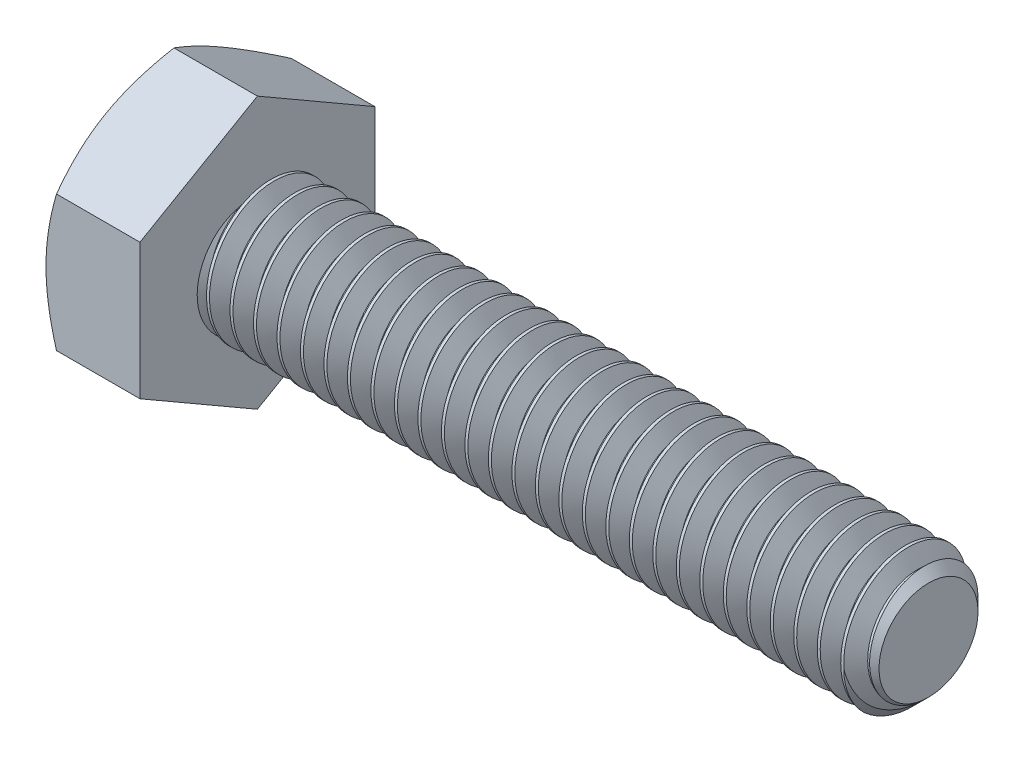
from build123d import *

# Parameters (mm, degrees)
SKETCH2_R           = 2
BOSS_EXTRUDE1_DEPTH = 20
CHAMFER1_SIZE       = 0.525
CUT_SWEEP1_PITCH    = 0.7
BOSS_EXTRUDE2_DEPTH = 2.8
SKETCH6_OUTSIDE_W   = 98.624
SKETCH6_OUTSIDE_H   = 99.706
SKETCH6_OUTSIDE_R   = 3.5
CUT_EXTRUDE1_DEPTH  = 24.418440157
CUT_EXTRUDE1_DRAFT  = -60


with BuildPart() as part:
    # Sketch2 → Boss-Extrude1 (new body)
    with BuildSketch(Plane(origin=(11.4, 0, 0), x_dir=(0, 0, -1), z_dir=(1, 0, 0))):
        Circle(SKETCH2_R)
    extrude(amount=-BOSS_EXTRUDE1_DEPTH)

    # Chamfer1
    chamfer1_edges = [part.edges().sort_by_distance(p)[0] for p in [
        (11.4, 0, 2),
    ]]
    chamfer(chamfer1_edges, length=CHAMFER1_SIZE)

    # Cut-Sweep1: the profile of Sketch5 profile screwed along a right-hand helix of 29.571429 turns, 6 arcs to a turn; built about Z, then put on its axis
    cut_sweep1_z = Axis((0, 0, 0), (0, 0, 1))
    cut_sweep1_corners = [(2.0003, 0, 0.000173205), (1.545336663, 0, -0.2625), (1.545336663, 0, -0.35), (2.0003, 0, -0.612673205)]
    with BuildLine(mode=Mode.PRIVATE) as cut_sweep1_profile:
        Line(cut_sweep1_corners[0], cut_sweep1_corners[1])
        Line(cut_sweep1_corners[1], cut_sweep1_corners[2])
        Line(cut_sweep1_corners[2], cut_sweep1_corners[3])
        Line(cut_sweep1_corners[3], cut_sweep1_corners[0])
    cut_sweep1_cap = Face(cut_sweep1_profile.wire())
    cut_sweep1_turn_angles = [0, 30, 60, 90, 120, 150, 180, 210, 240, 270, 300, 330, 360]
    cut_sweep1_turn_weights = [1, 0.8660254037844387, 1, 0.8660254037844387, 1, 0.8660254037844387, 1, 0.8660254037844387, 1, 0.8660254037844387, 1, 0.8660254037844387, 1]
    cut_sweep1_turn_rails = [Edge.make_bspline([Vector(p[0], p[1], 0).rotate(cut_sweep1_z, cut_sweep1_turn_angles[k]) / cut_sweep1_turn_weights[k] + Vector(0, 0, p[2] + CUT_SWEEP1_PITCH * cut_sweep1_turn_angles[k] / 360) for k in range(13)], [0, 0, 0, 1, 1, 2, 2, 3, 3, 4, 4, 5, 5, 6, 6, 6], 2, cut_sweep1_turn_weights) for p in cut_sweep1_corners]
    cut_sweep1_turn_sides = [Face.make_surface_from_curves(cut_sweep1_turn_rails[p[0]], cut_sweep1_turn_rails[p[1]]) for p in [(0, 1), (1, 2), (2, 3), (3, 0)]]
    cut_sweep1_last_angles = [10440, 10470, 10500, 10530, 10560, 10590, 10620, 10632.857142857, 10645.714285714]
    cut_sweep1_last_weights = [1, 0.8660254037844387, 1, 0.8660254037844387, 1, 0.8660254037844387, 1, 0.9749279121817342, 1]
    cut_sweep1_last_rails = [Edge.make_bspline([Vector(p[0], p[1], 0).rotate(cut_sweep1_z, cut_sweep1_last_angles[k]) / cut_sweep1_last_weights[k] + Vector(0, 0, p[2] + CUT_SWEEP1_PITCH * cut_sweep1_last_angles[k] / 360) for k in range(9)], [0, 0, 0, 1, 1, 2, 2, 3, 3, 4, 4, 4], 2, cut_sweep1_last_weights) for p in cut_sweep1_corners]
    cut_sweep1_last_sides = [Face.make_surface_from_curves(cut_sweep1_last_rails[p[0]], cut_sweep1_last_rails[p[1]]) for p in [(0, 1), (1, 2), (2, 3), (3, 0)]]
    cut_sweep1 = Plane(origin=(11.4, 0, 0), x_dir=(0, 1, 0), z_dir=(-1, 0, 0)) * Solid(Shell([*[p.moved(Location((0, 0, CUT_SWEEP1_PITCH * i))) for i in range(29) for p in cut_sweep1_turn_sides], *cut_sweep1_last_sides, cut_sweep1_cap, cut_sweep1_cap.rotate(cut_sweep1_z, 10645.714285714).moved(Location((0, 0, CUT_SWEEP1_PITCH * 10645.714285714 / 360)))]))
    add(cut_sweep1, mode=Mode.SUBTRACT)

    # Sketch3 → Boss-Extrude2 (add)
    with BuildSketch(Plane.ZY.offset(8.6)):
        Polygon((-3.5, -2.020725942), (0, -4.041451884), (3.5, -2.020725942), (3.5, 2.020725942), (0, 4.041451884), (-3.5, 2.020725942), align=None)
    extrude(amount=BOSS_EXTRUDE2_DEPTH)


with BuildPart() as cut_extrude1_tool:
    # Sketch6 outside → Cut-Extrude1 (with draft: the straight prism first)
    with BuildSketch(Plane.ZY.offset(11.4)):
        Rectangle(SKETCH6_OUTSIDE_W, SKETCH6_OUTSIDE_H)
        Circle(SKETCH6_OUTSIDE_R, mode=Mode.SUBTRACT)
    extrude(amount=-CUT_EXTRUDE1_DEPTH)
    # Cut-Extrude1: the draft: its side faces are tilted about the plane it starts from
    cut_extrude1_sides = [cut_extrude1_tool.faces().sort_by_distance(p)[0] for p in [
        (0.809220079, -49.853, 0),
        (0.809220079, 0, 49.312),
        (0.809220079, 49.853, 0),
        (0.809220079, 0, -49.312),
        (0.809220079, 0, -3.5),
    ]]
    draft(cut_extrude1_sides, Plane.ZY.offset(11.4), CUT_EXTRUDE1_DRAFT)


with BuildPart() as part_1:
    add(part.part)

    # Cut-Extrude1: cut by cut_extrude1_tool
    add(cut_extrude1_tool.part, mode=Mode.SUBTRACT)


solid = part_1.part
